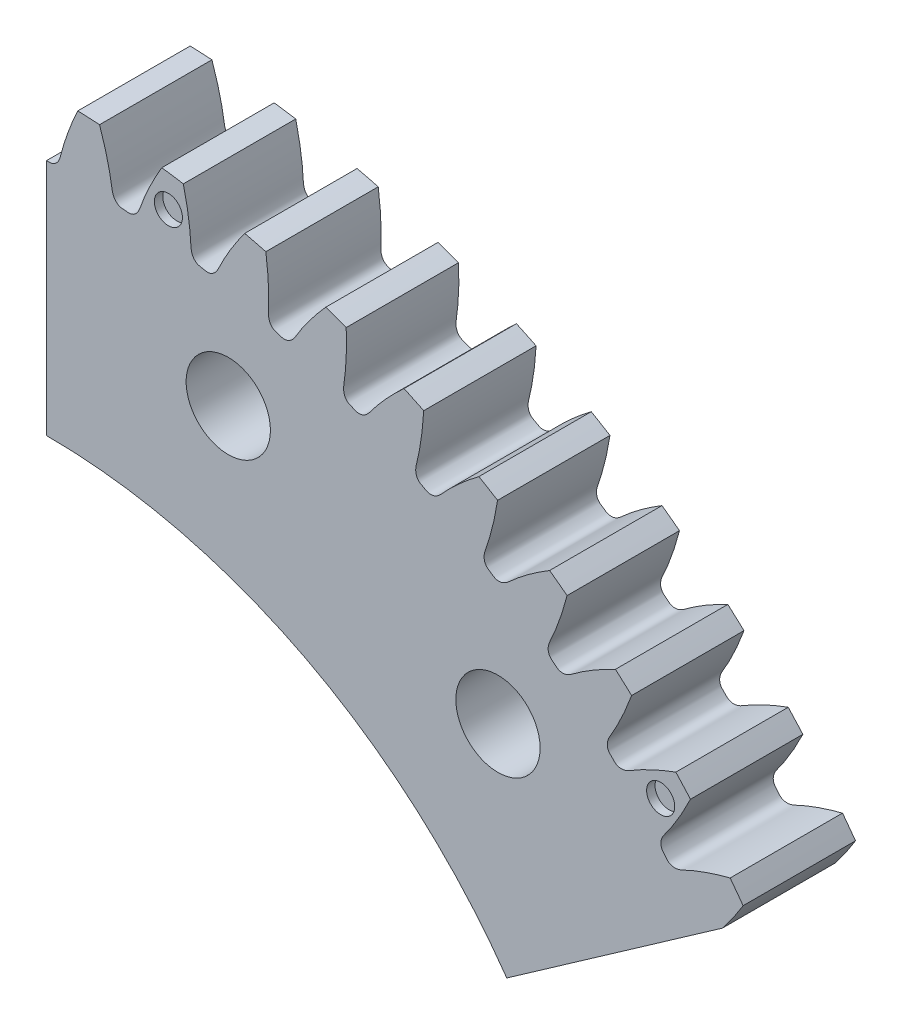
from build123d import *

# Parameters (mm, degrees)
SKETCHREVOLVESPURASSEMBLYNEW1GEAR_W       = 4
SKETCHREVOLVESPURASSEMBLYNEW1GEAR_H       = 30.5859375
TOOTHEXTRUDECUTSPURASSEMBLYNEW1GEAR_DEPTH = 4
PATTERNSPURASSEMBLYNEW1GEAR_COUNT         = 64
SKETCH_1_R                                = 1.5
CUT_EXTRUDE_1_DEPTH                       = 44.411058149
SKETCH_2_R                                = 0.5
CUT_EXTRUDE_6_DEPTH                       = 0.3


with BuildPart() as part:
    # SketchRevolveSpurAssemblyNew1Gear → SpurAssemblyNew1Gear (revolve)
    with BuildSketch(Plane(origin=(0, 0, 0), x_dir=(0, 0, -1), z_dir=(1, 0, 0))):
        with Locations((-2, 15.29296875)):
            Rectangle(SKETCHREVOLVESPURASSEMBLYNEW1GEAR_W, SKETCHREVOLVESPURASSEMBLYNEW1GEAR_H)
    revolve(axis=Axis((0, 0, 0), (0, 0, -1)))

    # SketchToothSpurAssemblyNew1Gear → ToothExtrudeCutSpurAssemblyNew1Gear (cut, symmetric)
    with BuildSketch(Plane.XY):
        with BuildLine():
            ThreePointArc((30.594491129, 1.126804494), (30.615234375, 0), (30.594491129, -1.126804494))
            add(Edge.make_bspline(
                [(30.594491129, -1.126804494), (30.513153248, -1.08876469), (30.392229292, -1.033862439), (30.232059487, -0.964523298), (30.116582931, -0.916114411), (30.004066749, -0.870473087), (29.894559131, -0.82752397), (29.788106911, -0.787190952), (29.68475557, -0.749397187), (29.584549189, -0.714065215), (29.487530555, -0.681116604), (29.393740749, -0.650473314), (29.303220551, -0.62205298), (29.216005463, -0.595785619), (29.132143126, -0.571555086), (29.051632325, -0.54940409), (28.953014436, -0.523038193), (28.872991777, -0.504974278), (28.812904254, -0.486133125), (28.791326421, -0.478779456), (28.770140086, -0.470929703), (28.749294691, -0.462524821), (28.728733016, -0.453489475), (28.708392896, -0.443727817), (28.68820819, -0.433118056), (28.668111681, -0.421505822), (28.648040322, -0.408696301), (28.627944409, -0.394445536), (28.607802663, -0.378452075), (28.587645794, -0.360351626), (28.567591022, -0.339719861), (28.547888439, -0.31609213), (28.528974517, -0.28901227), (28.511518918, -0.258123977), (28.496429245, -0.223305066), (28.484793836, -0.184833774), (28.478017662, -0.145607099), (28.474929153, -0.083645735), (28.477779142, 0), (28.474929153, 0.083645735), (28.478017662, 0.145607099), (28.484793836, 0.184833774), (28.496429245, 0.223305066), (28.511518918, 0.258123977), (28.528974517, 0.28901227), (28.547888439, 0.31609213), (28.567591022, 0.339719861), (28.587645794, 0.360351626), (28.607802663, 0.378452075), (28.627944409, 0.394445536), (28.648040322, 0.408696301), (28.668111681, 0.421505822), (28.68820819, 0.433118056), (28.708392896, 0.443727817), (28.728733016, 0.453489475), (28.749294691, 0.462524821), (28.770140086, 0.470929703), (28.791326421, 0.478779456), (28.812904254, 0.486133125), (28.872991777, 0.504974278), (28.953014436, 0.523038193), (29.051632325, 0.54940409), (29.132143126, 0.571555086), (29.216005463, 0.595785619), (29.303220551, 0.62205298), (29.393740749, 0.650473314), (29.487530555, 0.681116604), (29.584549189, 0.714065215), (29.68475557, 0.749397187), (29.788106911, 0.787190952), (29.894559131, 0.82752397), (30.004066749, 0.870473087), (30.116582931, 0.916114411), (30.232059487, 0.964523298), (30.392229292, 1.033862439), (30.513153248, 1.08876469), (30.594491129, 1.126804494)],
                knots=[0, 0, 0, 0, 0.052869434, 0.078187828, 0.102762008, 0.126591972, 0.149677722, 0.172019257, 0.193616576, 0.214469681, 0.234578571, 0.253943246, 0.272563705, 0.29043995, 0.30757198, 0.323959795, 0.339603395, 0.36768142, 0.372205404, 0.376674404, 0.381102619, 0.385506692, 0.389906194, 0.394324187, 0.398787872, 0.403329308, 0.407986154, 0.412802328, 0.417828375, 0.423121184, 0.428742439, 0.434754921, 0.441215584, 0.448164507, 0.455610022, 0.463512883, 0.471775764, 0.478976419, 0.5, 0.521023581, 0.528224236, 0.536487117, 0.544389978, 0.551835493, 0.558784416, 0.565245079, 0.571257561, 0.576878816, 0.582171625, 0.587197672, 0.592013846, 0.596670692, 0.601212128, 0.605675813, 0.610093806, 0.614493308, 0.618897381, 0.623325596, 0.627794596, 0.63231858, 0.660396605, 0.676040205, 0.69242802, 0.70956005, 0.727436295, 0.746056754, 0.765421429, 0.785530319, 0.806383424, 0.827980743, 0.850322278, 0.873408028, 0.897237992, 0.921812172, 0.947130566, 1, 1, 1, 1], degree=3))
        make_face()
    toothextrudecutspurassemblynew1gear = extrude(amount=TOOTHEXTRUDECUTSPURASSEMBLYNEW1GEAR_DEPTH, both=True, mode=Mode.SUBTRACT)

    # PatternSpurAssemblyNew1Gear: ToothExtrudeCutSpurAssemblyNew1Gear ×64 about axis
    patternspurassemblynew1gear_axis = Axis((0, 0, 50), (0, 0, -1))
    for i in range(1, PATTERNSPURASSEMBLYNEW1GEAR_COUNT):
        add(toothextrudecutspurassemblynew1gear.rotate(patternspurassemblynew1gear_axis, i * 360 / PATTERNSPURASSEMBLYNEW1GEAR_COUNT), mode=Mode.SUBTRACT)

    # Эскиз1 → Вырез-Вытянуть1 (cut, through all)
    with BuildSketch(Plane.XY.offset(4)):
        with Locations((6.470476128, 24.148145657)):
            Circle(SKETCH_1_R)
        with Locations((16.069690242, 19.151111078)):
            Circle(SKETCH_1_R)
        with BuildLine():
            Line((0, 20), (0, 39.152336204))
            ThreePointArc((0, 39.152336204), (-18.078536947, -34.728546357), (32.07171624, 22.456857475))
            Line((32.07171624, 22.456857475), (16.383040886, 11.471528727))
            ThreePointArc((16.383040886, 11.471528727), (9.234972265, 17.740216664), (0, 20))
        make_face()
    extrude(amount=-CUT_EXTRUDE_1_DEPTH, mode=Mode.SUBTRACT)

    # Эскиз2 → Вырез-Вытянуть6 (cut)
    with BuildSketch(Plane.XY.offset(4)):
        with Locations((4.338089726, 29.136349975)):
            Circle(SKETCH_2_R)
        with Locations((21.860646125, 19.74482371)):
            Circle(SKETCH_2_R)
    extrude(amount=-CUT_EXTRUDE_6_DEPTH, mode=Mode.SUBTRACT)


solid = part.part
